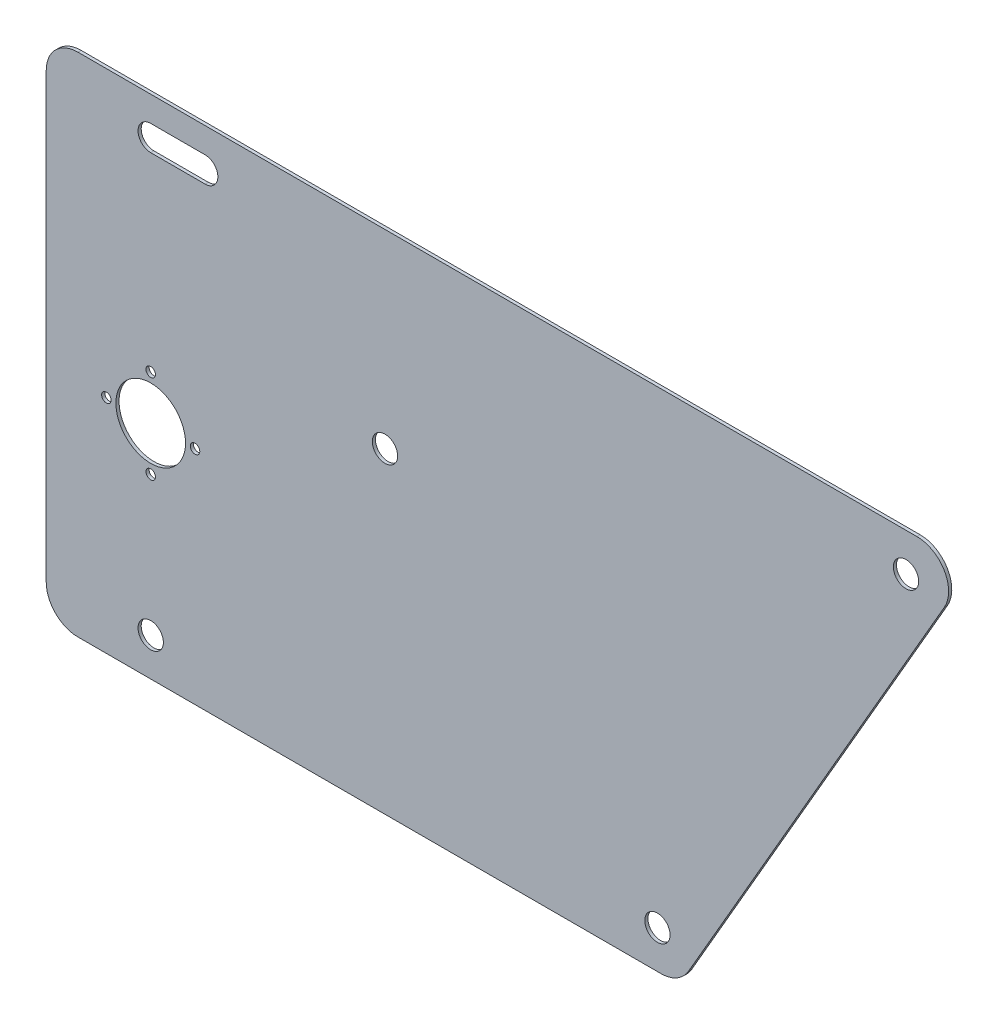
from build123d import *

# Parameters (mm, degrees)
BOSS_EXTRUDE1_DEPTH = 1
FILLET1_R           = 10
SKETCH2_R           = 4
SKETCH2_R_2         = 11
SKETCH2_R_3         = 1.5
CUT_EXTRUDE1_DEPTH  = 3


with BuildPart() as part:
    # Sketch1 → Boss-Extrude1 (new body)
    with BuildSketch(Plane.XY):
        Polygon((-100, -80), (100, -80), (192.37604307, 80), (-100, 80), align=None)
    extrude(amount=BOSS_EXTRUDE1_DEPTH)

    # Fillet1
    fillet1_edges = [part.edges().sort_by_distance(p)[0] for p in [
        (192.37604307, 80, 0.5),
        (100, -80, 0.5),
        (-100, -80, 0.5),
        (-100, 80, 0.5),
    ]]
    fillet(fillet1_edges, radius=FILLET1_R)

    # Sketch2 → Cut-Extrude1 (cut)
    with BuildSketch(Plane.XY.offset(1)):
        with Locations((93.07179677, -68)):
            Circle(SKETCH2_R)
        with Locations((171.59143338, 68)):
            Circle(SKETCH2_R)
        with Locations((-67, -10)):
            Circle(SKETCH2_R_2)
        with Locations((-67, -68)):
            Circle(SKETCH2_R)
        with Locations((-53, -10)):
            Circle(SKETCH2_R_3)
        with Locations((-67, 4)):
            Circle(SKETCH2_R_3)
        with Locations((-81, -10)):
            Circle(SKETCH2_R_3)
        with Locations((-67, -24)):
            Circle(SKETCH2_R_3)
        with Locations((6.998807119, 20)):
            Circle(SKETCH2_R)
        with BuildLine():
            Line((-67, 72), (-49.783746602, 72))
            ThreePointArc((-49.783746602, 72), (-45.783746602, 68), (-49.783746602, 64))
            Line((-49.783746602, 64), (-67, 64))
            ThreePointArc((-67, 64), (-71, 68), (-67, 72))
        make_face()
    extrude(amount=-CUT_EXTRUDE1_DEPTH, mode=Mode.SUBTRACT)


solid = part.part
